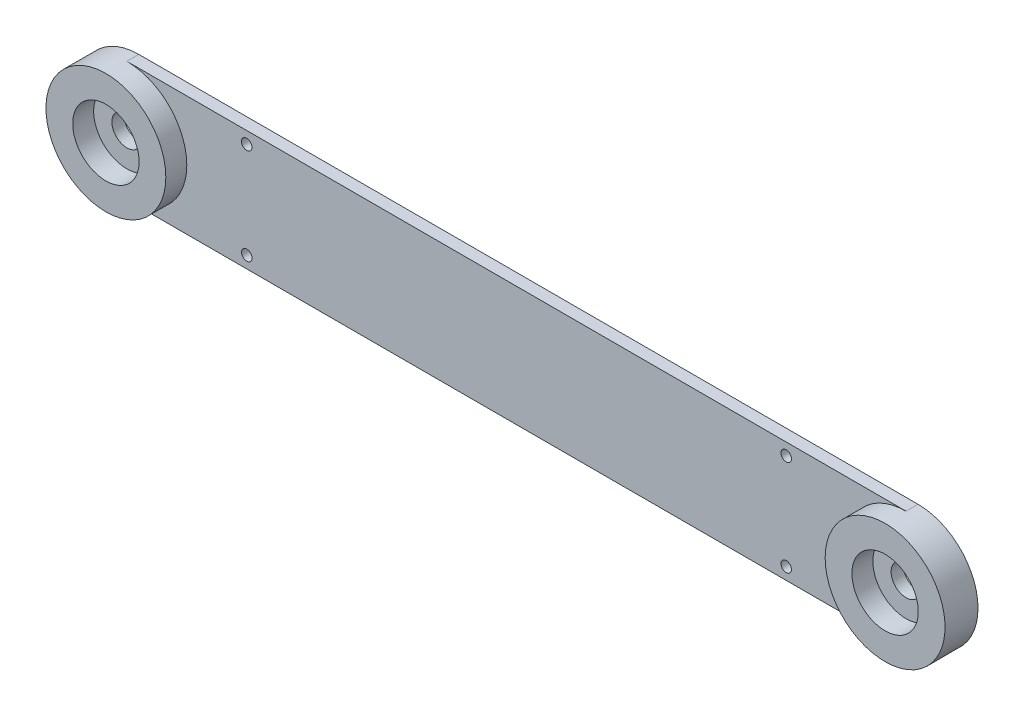
from build123d import *

# Parameters (mm, degrees)
AUFSATZ_LINEAR_AUSTRAGEN1_DEPTH = 4
SKIZZE2_R                       = 20
SKIZZE2_R_2                     = 11.075
AUFSATZ_LINEAR_AUSTRAGEN2_DEPTH = 7
SKIZZE3_R                       = 5
SCHNITT_LINEAR_AUSTRAGEN1_DEPTH = 152.489273548
SKIZZE4_R                       = 1.75
SCHNITT_LINEAR_AUSTRAGEN2_DEPTH = 152.489273548


with BuildPart() as part:
    # Skizze1 → Aufsatz-Linear austragen1 (new body)
    with BuildSketch(Plane.XY):
        with BuildLine():
            Line((-130, -20), (130, -20))
            ThreePointArc((130, -20), (150, 0), (130, 20))
            Line((130, 20), (-130, 20))
            ThreePointArc((-130, 20), (-150, 0), (-130, -20))
        make_face()
    extrude(amount=AUFSATZ_LINEAR_AUSTRAGEN1_DEPTH)

    # Skizze2 → Aufsatz-Linear austragen2 (add)
    with BuildSketch(Plane.XY.offset(4)):
        with Locations((-130, 0)):
            Circle(SKIZZE2_R)
        with Locations((-130, 0)):
            Circle(SKIZZE2_R_2, mode=Mode.SUBTRACT)
    aufsatz_linear_austragen2 = extrude(amount=AUFSATZ_LINEAR_AUSTRAGEN2_DEPTH)

    # Skizze3 → Schnitt-Linear austragen1 (cut, symmetric)
    with BuildSketch(Plane.XY.offset(4)):
        with Locations((-130, 0)):
            Circle(SKIZZE3_R)
    schnitt_linear_austragen1 = extrude(amount=SCHNITT_LINEAR_AUSTRAGEN1_DEPTH, both=True, mode=Mode.SUBTRACT)

    # Spiegeln1: Aufsatz-Linear austragen2, Schnitt-Linear austragen1 across plane
    add(aufsatz_linear_austragen2.mirror(Plane(origin=(0, 0, 0), x_dir=(0, 0, 1), z_dir=(1, 0, 0))))
    add(schnitt_linear_austragen1.mirror(Plane(origin=(0, 0, 0), x_dir=(0, 0, 1), z_dir=(1, 0, 0))), mode=Mode.SUBTRACT)

    # Skizze4 → Schnitt-Linear austragen2 (cut, through all)
    with BuildSketch(Plane.XY.offset(4)):
        with Locations((-90, 16)):
            Circle(SKIZZE4_R)
        with Locations((-90, -16)):
            Circle(SKIZZE4_R)
        with Locations((90, -16)):
            Circle(SKIZZE4_R)
        with Locations((90, 16)):
            Circle(SKIZZE4_R)
    extrude(amount=-SCHNITT_LINEAR_AUSTRAGEN2_DEPTH, mode=Mode.SUBTRACT)


solid = part.part
